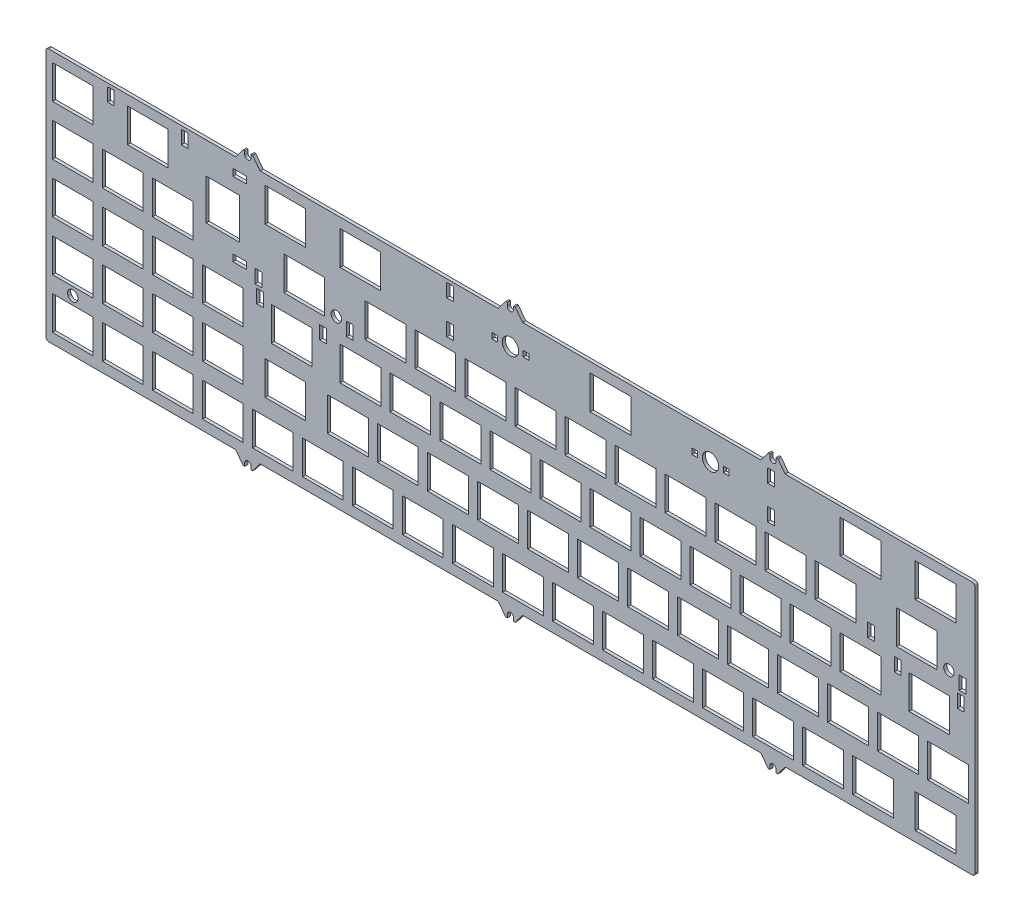
from build123d import *

# Parameters (mm, degrees)
SKETCH2_R           = 3.125
SKETCH2_R_2         = 2
SKETCH2_W           = 15.6
SKETCH2_H           = 12.8
SKETCH2_W_2         = 2.6
SKETCH2_H_2         = 5.1
SKETCH2_W_3         = 2.2
SKETCH2_H_3         = 2.2
SKETCH2_W_4         = 5.1
SKETCH2_H_4         = 2.6
SKETCH2_W_5         = 15.5
SKETCH2_W_6         = 12.8
SKETCH2_H_5         = 15.5
BOSS_EXTRUDE1_DEPTH = 1.2


with BuildPart() as part:
    # Sketch2 → Boss-Extrude1 (new body)
    with BuildSketch(Plane(origin=(0, 0, 0), x_dir=(1, 0, 0), z_dir=(0, 0, -1))):
        with BuildLine():
            Line((-4.122e-06, 4.749999815), (-4.122e-06, 99.349999815))
            ThreePointArc((-4.122e-06, 99.349999815), (0.292889097, 100.057106597), (0.999995878, 100.349999815))
            Line((0.999995878, 100.349999815), (72.237495878, 100.349999815))
            Line((72.237495878, 100.349999815), (75.087495878, 104.099999815))
            Line((75.087495878, 104.099999815), (75.687495878, 104.099999815))
            Line((75.687495878, 104.099999815), (75.687495878, 103.599999815))
            Line((75.687495878, 103.599999815), (75.687495878, 102.849999815))
            ThreePointArc((75.687495878, 102.849999815), (76.887495878, 101.649999815), (78.087495878, 102.849999815))
            Line((78.087495878, 102.849999815), (78.087495878, 103.599999815))
            Line((78.087495878, 103.599999815), (78.087495878, 104.099999815))
            Line((78.087495878, 104.099999815), (78.687495879, 104.099999815))
            Line((78.687495879, 104.099999815), (81.537495879, 100.349999815))
            Line((81.537495879, 100.349999815), (172.237495878, 100.349999815))
            Line((172.237495878, 100.349999815), (175.087495878, 104.099999815))
            Line((175.087495878, 104.099999815), (175.687495878, 104.099999815))
            Line((175.687495878, 104.099999815), (175.687495878, 102.849999815))
            ThreePointArc((175.687495878, 102.849999815), (176.887495878, 101.649999815), (178.087495878, 102.849999815))
            Line((178.087495878, 102.849999815), (178.087495878, 104.099999815))
            Line((178.087495878, 104.099999815), (178.687495878, 104.099999815))
            Line((178.687495878, 104.099999815), (181.537495878, 100.349999815))
            Line((181.537495878, 100.349999815), (272.237495878, 100.349999815))
            Line((272.237495878, 100.349999815), (275.087495878, 104.099999815))
            Line((275.087495878, 104.099999815), (275.687495878, 104.099999815))
            Line((275.687495878, 104.099999815), (275.687495878, 102.849999815))
            ThreePointArc((275.687495878, 102.849999815), (276.887495878, 101.649999815), (278.087495878, 102.849999815))
            Line((278.087495878, 102.849999815), (278.087495878, 104.099999815))
            Line((278.087495878, 104.099999815), (278.687495878, 104.099999815))
            Line((278.687495878, 104.099999815), (281.537495878, 100.349999815))
            Line((281.537495878, 100.349999815), (352.774995878, 100.349999815))
            ThreePointArc((352.774995878, 100.349999815), (353.48210266, 100.057106597), (353.774995878, 99.349999815))
            Line((353.774995878, 99.349999815), (353.774995878, 4.749999815))
            ThreePointArc((353.774995878, 4.749999815), (353.48210266, 4.042893034), (352.774995878, 3.749999815))
            Line((352.774995878, 3.749999815), (281.537495878, 3.749999815))
            Line((281.537495878, 3.749999815), (278.687495878, -1.85e-07))
            Line((278.687495878, -1.85e-07), (278.087495878, -1.85e-07))
            Line((278.087495878, -1.85e-07), (278.087495878, 1.249999815))
            ThreePointArc((278.087495878, 1.249999815), (276.887495878, 2.449999815), (275.687495878, 1.249999815))
            Line((275.687495878, 1.249999815), (275.687495878, -1.85e-07))
            Line((275.687495878, -1.85e-07), (275.087495878, -1.85e-07))
            Line((275.087495878, -1.85e-07), (272.237495878, 3.749999815))
            Line((272.237495878, 3.749999815), (181.537495878, 3.749999815))
            Line((181.537495878, 3.749999815), (178.687495878, -1.85e-07))
            Line((178.687495878, -1.85e-07), (178.087495878, -1.85e-07))
            Line((178.087495878, -1.85e-07), (178.087495878, 1.249999815))
            ThreePointArc((178.087495878, 1.249999815), (176.887495878, 2.449999815), (175.687495878, 1.249999815))
            Line((175.687495878, 1.249999815), (175.687495878, -1.85e-07))
            Line((175.687495878, -1.85e-07), (175.087495878, -1.85e-07))
            Line((175.087495878, -1.85e-07), (172.237495878, 3.749999815))
            Line((172.237495878, 3.749999815), (81.537495879, 3.749999815))
            Line((81.537495879, 3.749999815), (78.687495879, -1.85e-07))
            Line((78.687495879, -1.85e-07), (78.087495878, -1.85e-07))
            Line((78.087495878, -1.85e-07), (78.087495878, 0.499999815))
            Line((78.087495878, 0.499999815), (78.087495878, 1.249999815))
            ThreePointArc((78.087495878, 1.249999815), (76.887495878, 2.449999815), (75.687495878, 1.249999815))
            Line((75.687495878, 1.249999815), (75.687495878, 0.499999815))
            Line((75.687495878, 0.499999815), (75.687495878, -1.85e-07))
            Line((75.687495878, -1.85e-07), (75.087495878, -1.85e-07))
            Line((75.087495878, -1.85e-07), (72.237495878, 3.749999815))
            Line((72.237495878, 3.749999815), (0.999995878, 3.749999815))
            ThreePointArc((0.999995878, 3.749999815), (0.292889097, 4.042893034), (-4.122e-06, 4.749999815))
        make_face()
        with Locations((176.887495878, 13.949999815)):
            Circle(SKETCH2_R, mode=Mode.SUBTRACT)
        with Locations((253.087495878, 13.949999815)):
            Circle(SKETCH2_R, mode=Mode.SUBTRACT)
        with Locations((343.918745878, 37.249999815)):
            Circle(SKETCH2_R_2, mode=Mode.SUBTRACT)
        with Locations((110.556245878, 37.249999815)):
            Circle(SKETCH2_R_2, mode=Mode.SUBTRACT)
        with Locations((10.199995878, 80.624999815)):
            Circle(SKETCH2_R_2, mode=Mode.SUBTRACT)
        with Locations((129.262495878, 32.999999815)):
            Rectangle(SKETCH2_W, SKETCH2_H, mode=Mode.SUBTRACT)
        with Locations((119.737495878, 52.049999815)):
            Rectangle(SKETCH2_W, SKETCH2_H, mode=Mode.SUBTRACT)
        with Locations((114.974995878, 71.099999815)):
            Rectangle(SKETCH2_W, SKETCH2_H, mode=Mode.SUBTRACT)
        with Locations((324.431248691, 45.649999553)):
            Rectangle(SKETCH2_W_2, SKETCH2_H_2, mode=Mode.SUBTRACT)
        with Locations((348.431245878, 45.649999815)):
            Rectangle(SKETCH2_W_2, SKETCH2_H_2, mode=Mode.SUBTRACT)
        with Locations((105.543745878, 45.649999815)):
            Rectangle(SKETCH2_W_2, SKETCH2_H_2, mode=Mode.SUBTRACT)
        with Locations((314.268745878, 39.399999815)):
            Rectangle(SKETCH2_W_2, SKETCH2_H_2, mode=Mode.SUBTRACT)
        with Locations((349.068745878, 39.399999815)):
            Rectangle(SKETCH2_W_2, SKETCH2_H_2, mode=Mode.SUBTRACT)
        with Locations((115.706245878, 39.399999815)):
            Rectangle(SKETCH2_W_2, SKETCH2_H_2, mode=Mode.SUBTRACT)
        with Locations((153.887495878, 7.549999815)):
            Rectangle(SKETCH2_W_2, SKETCH2_H_2, mode=Mode.SUBTRACT)
        with Locations((182.862495878, 13.949999815)):
            Rectangle(SKETCH2_W_3, SKETCH2_H_3, mode=Mode.SUBTRACT)
        with Locations((170.912495878, 13.949999815)):
            Rectangle(SKETCH2_W_3, SKETCH2_H_3, mode=Mode.SUBTRACT)
        with Locations((247.112495878, 13.949999815)):
            Rectangle(SKETCH2_W_3, SKETCH2_H_3, mode=Mode.SUBTRACT)
        with Locations((259.062495878, 13.949999815)):
            Rectangle(SKETCH2_W_3, SKETCH2_H_3, mode=Mode.SUBTRACT)
        with Locations((81.543748691, 45.649999553)):
            Rectangle(SKETCH2_W_2, SKETCH2_H_2, mode=Mode.SUBTRACT)
        with Locations((80.906245878, 39.399999815)):
            Rectangle(SKETCH2_W_2, SKETCH2_H_2, mode=Mode.SUBTRACT)
        with Locations((24.674995878, 7.549999815)):
            Rectangle(SKETCH2_W_2, SKETCH2_H_2, mode=Mode.SUBTRACT)
        with Locations((52.874995878, 7.549999815)):
            Rectangle(SKETCH2_W_2, SKETCH2_H_2, mode=Mode.SUBTRACT)
        with Locations((73.749995878, 9.374999815)):
            Rectangle(SKETCH2_W_4, SKETCH2_H_4, mode=Mode.SUBTRACT)
        with Locations((73.749995878, 37.574999815)):
            Rectangle(SKETCH2_W_4, SKETCH2_H_4, mode=Mode.SUBTRACT)
        with Locations((153.887495878, 20.349999815)):
            Rectangle(SKETCH2_W_2, SKETCH2_H_2, mode=Mode.SUBTRACT)
        with Locations((276.087495878, 20.349999815)):
            Rectangle(SKETCH2_W_2, SKETCH2_H_2, mode=Mode.SUBTRACT)
        with Locations((276.087495878, 7.549999815)):
            Rectangle(SKETCH2_W_2, SKETCH2_H_2, mode=Mode.SUBTRACT)
        with Locations((338.812495878, 90.149999815)):
            Rectangle(SKETCH2_W_5, SKETCH2_H, mode=Mode.SUBTRACT)
        with Locations((314.999995878, 90.149999815)):
            Rectangle(SKETCH2_W_5, SKETCH2_H, mode=Mode.SUBTRACT)
        with Locations((295.949995878, 90.149999815)):
            Rectangle(SKETCH2_W_5, SKETCH2_H, mode=Mode.SUBTRACT)
        with Locations((276.899995878, 90.149999815)):
            Rectangle(SKETCH2_W_5, SKETCH2_H, mode=Mode.SUBTRACT)
        with Locations((257.849995878, 90.149999815)):
            Rectangle(SKETCH2_W_5, SKETCH2_H, mode=Mode.SUBTRACT)
        with Locations((238.799995878, 90.149999815)):
            Rectangle(SKETCH2_W_5, SKETCH2_H, mode=Mode.SUBTRACT)
        with Locations((219.749995878, 90.149999815)):
            Rectangle(SKETCH2_W_5, SKETCH2_H, mode=Mode.SUBTRACT)
        with Locations((200.699995878, 90.149999815)):
            Rectangle(SKETCH2_W_5, SKETCH2_H, mode=Mode.SUBTRACT)
        with Locations((181.649995878, 90.149999815)):
            Rectangle(SKETCH2_W_5, SKETCH2_H, mode=Mode.SUBTRACT)
        with Locations((162.599995878, 90.149999815)):
            Rectangle(SKETCH2_W_5, SKETCH2_H, mode=Mode.SUBTRACT)
        with Locations((143.549995878, 90.149999815)):
            Rectangle(SKETCH2_W_5, SKETCH2_H, mode=Mode.SUBTRACT)
        with Locations((124.499995878, 90.149999815)):
            Rectangle(SKETCH2_W_5, SKETCH2_H, mode=Mode.SUBTRACT)
        with Locations((105.449995878, 90.149999815)):
            Rectangle(SKETCH2_W_5, SKETCH2_H, mode=Mode.SUBTRACT)
        with Locations((86.399995878, 90.149999815)):
            Rectangle(SKETCH2_W_5, SKETCH2_H, mode=Mode.SUBTRACT)
        with Locations((67.349995878, 71.099999815)):
            Rectangle(SKETCH2_W_5, SKETCH2_H, mode=Mode.SUBTRACT)
        with Locations((67.349995878, 90.149999815)):
            Rectangle(SKETCH2_W_5, SKETCH2_H, mode=Mode.SUBTRACT)
        with Locations((48.299995878, 71.099999815)):
            Rectangle(SKETCH2_W_5, SKETCH2_H, mode=Mode.SUBTRACT)
        with Locations((48.299995878, 90.149999815)):
            Rectangle(SKETCH2_W_5, SKETCH2_H, mode=Mode.SUBTRACT)
        with Locations((29.249995878, 71.099999815)):
            Rectangle(SKETCH2_W_5, SKETCH2_H, mode=Mode.SUBTRACT)
        with Locations((29.249995878, 90.149999815)):
            Rectangle(SKETCH2_W_5, SKETCH2_H, mode=Mode.SUBTRACT)
        with Locations((10.199995878, 71.099999815)):
            Rectangle(SKETCH2_W_5, SKETCH2_H, mode=Mode.SUBTRACT)
        with Locations((10.199995878, 90.149999815)):
            Rectangle(SKETCH2_W_5, SKETCH2_H, mode=Mode.SUBTRACT)
        with Locations((67.299995878, 52.049999815)):
            Rectangle(SKETCH2_W_5, SKETCH2_H, mode=Mode.SUBTRACT)
        with Locations((48.249995878, 52.049999815)):
            Rectangle(SKETCH2_W_5, SKETCH2_H, mode=Mode.SUBTRACT)
        with Locations((29.199995878, 52.049999815)):
            Rectangle(SKETCH2_W_5, SKETCH2_H, mode=Mode.SUBTRACT)
        with Locations((10.149995878, 52.049999815)):
            Rectangle(SKETCH2_W_5, SKETCH2_H, mode=Mode.SUBTRACT)
        with Locations((48.249995878, 32.999999815)):
            Rectangle(SKETCH2_W_5, SKETCH2_H, mode=Mode.SUBTRACT)
        with Locations((29.199995878, 32.999999815)):
            Rectangle(SKETCH2_W_5, SKETCH2_H, mode=Mode.SUBTRACT)
        with Locations((10.149995878, 32.999999815)):
            Rectangle(SKETCH2_W_5, SKETCH2_H, mode=Mode.SUBTRACT)
        with Locations((10.199995878, 13.949999815)):
            Rectangle(SKETCH2_W_5, SKETCH2_H, mode=Mode.SUBTRACT)
        with Locations((38.774995878, 13.949999815)):
            Rectangle(SKETCH2_W_5, SKETCH2_H, mode=Mode.SUBTRACT)
        with Locations((91.162495878, 13.949999815)):
            Rectangle(SKETCH2_W_5, SKETCH2_H, mode=Mode.SUBTRACT)
        with Locations((119.737495878, 13.949999815)):
            Rectangle(SKETCH2_W_5, SKETCH2_H, mode=Mode.SUBTRACT)
        with Locations((98.306245878, 32.999999815)):
            Rectangle(SKETCH2_W_5, SKETCH2_H, mode=Mode.SUBTRACT)
        with Locations((93.543745878, 52.049999815)):
            Rectangle(SKETCH2_W_5, SKETCH2_H, mode=Mode.SUBTRACT)
        with Locations((91.162495878, 71.099999815)):
            Rectangle(SKETCH2_W_5, SKETCH2_H, mode=Mode.SUBTRACT)
        with Locations((336.431245878, 52.049999815)):
            Rectangle(SKETCH2_W_5, SKETCH2_H, mode=Mode.SUBTRACT)
        with Locations((214.987495878, 13.949999815)):
            Rectangle(SKETCH2_W_5, SKETCH2_H, mode=Mode.SUBTRACT)
        with Locations((310.237495879, 13.949999815)):
            Rectangle(SKETCH2_W_5, SKETCH2_H, mode=Mode.SUBTRACT)
        with Locations((331.668745878, 32.999999815)):
            Rectangle(SKETCH2_W_5, SKETCH2_H, mode=Mode.SUBTRACT)
        with Locations((338.812495879, 13.949999815)):
            Rectangle(SKETCH2_W_5, SKETCH2_H, mode=Mode.SUBTRACT)
        with Locations((67.349995878, 23.474999815)):
            Rectangle(SKETCH2_W_6, SKETCH2_H_5, mode=Mode.SUBTRACT)
        with Locations((286.424995878, 71.099999815)):
            Rectangle(SKETCH2_W_5, SKETCH2_H, mode=Mode.SUBTRACT)
        with Locations((267.374995878, 71.099999815)):
            Rectangle(SKETCH2_W_5, SKETCH2_H, mode=Mode.SUBTRACT)
        with Locations((248.324995878, 71.099999815)):
            Rectangle(SKETCH2_W_5, SKETCH2_H, mode=Mode.SUBTRACT)
        with Locations((229.274995878, 71.099999815)):
            Rectangle(SKETCH2_W_5, SKETCH2_H, mode=Mode.SUBTRACT)
        with Locations((210.224995878, 71.099999815)):
            Rectangle(SKETCH2_W_5, SKETCH2_H, mode=Mode.SUBTRACT)
        with Locations((191.174995878, 71.099999815)):
            Rectangle(SKETCH2_W_5, SKETCH2_H, mode=Mode.SUBTRACT)
        with Locations((172.124995878, 71.099999815)):
            Rectangle(SKETCH2_W_5, SKETCH2_H, mode=Mode.SUBTRACT)
        with Locations((153.074995878, 71.099999815)):
            Rectangle(SKETCH2_W_5, SKETCH2_H, mode=Mode.SUBTRACT)
        with Locations((134.024995878, 71.099999815)):
            Rectangle(SKETCH2_W_5, SKETCH2_H, mode=Mode.SUBTRACT)
        with Locations((291.187495878, 52.049999815)):
            Rectangle(SKETCH2_W_5, SKETCH2_H, mode=Mode.SUBTRACT)
        with Locations((272.137495878, 52.049999815)):
            Rectangle(SKETCH2_W_5, SKETCH2_H, mode=Mode.SUBTRACT)
        with Locations((253.087495878, 52.049999815)):
            Rectangle(SKETCH2_W_5, SKETCH2_H, mode=Mode.SUBTRACT)
        with Locations((234.037495878, 52.049999815)):
            Rectangle(SKETCH2_W_5, SKETCH2_H, mode=Mode.SUBTRACT)
        with Locations((214.987495878, 52.049999815)):
            Rectangle(SKETCH2_W_5, SKETCH2_H, mode=Mode.SUBTRACT)
        with Locations((195.937495878, 52.049999815)):
            Rectangle(SKETCH2_W_5, SKETCH2_H, mode=Mode.SUBTRACT)
        with Locations((176.887495878, 52.049999815)):
            Rectangle(SKETCH2_W_5, SKETCH2_H, mode=Mode.SUBTRACT)
        with Locations((157.837495878, 52.049999815)):
            Rectangle(SKETCH2_W_5, SKETCH2_H, mode=Mode.SUBTRACT)
        with Locations((138.787495878, 52.049999815)):
            Rectangle(SKETCH2_W_5, SKETCH2_H, mode=Mode.SUBTRACT)
        with Locations((300.712495878, 32.999999815)):
            Rectangle(SKETCH2_W_5, SKETCH2_H, mode=Mode.SUBTRACT)
        with Locations((281.662495878, 32.999999815)):
            Rectangle(SKETCH2_W_5, SKETCH2_H, mode=Mode.SUBTRACT)
        with Locations((262.612495878, 32.999999815)):
            Rectangle(SKETCH2_W_5, SKETCH2_H, mode=Mode.SUBTRACT)
        with Locations((243.562495878, 32.999999815)):
            Rectangle(SKETCH2_W_5, SKETCH2_H, mode=Mode.SUBTRACT)
        with Locations((224.512495878, 32.999999815)):
            Rectangle(SKETCH2_W_5, SKETCH2_H, mode=Mode.SUBTRACT)
        with Locations((205.462495878, 32.999999815)):
            Rectangle(SKETCH2_W_5, SKETCH2_H, mode=Mode.SUBTRACT)
        with Locations((186.412495878, 32.999999815)):
            Rectangle(SKETCH2_W_5, SKETCH2_H, mode=Mode.SUBTRACT)
        with Locations((167.362495878, 32.999999815)):
            Rectangle(SKETCH2_W_5, SKETCH2_H, mode=Mode.SUBTRACT)
        with Locations((148.312495878, 32.999999815)):
            Rectangle(SKETCH2_W_5, SKETCH2_H, mode=Mode.SUBTRACT)
        with Locations((343.574995878, 71.099999815)):
            Rectangle(SKETCH2_W_5, SKETCH2_H, mode=Mode.SUBTRACT)
        with Locations((324.524995878, 71.099999815)):
            Rectangle(SKETCH2_W_5, SKETCH2_H, mode=Mode.SUBTRACT)
        with Locations((305.474995878, 71.099999815)):
            Rectangle(SKETCH2_W_5, SKETCH2_H, mode=Mode.SUBTRACT)
        with Locations((310.237495878, 52.049999815)):
            Rectangle(SKETCH2_W_5, SKETCH2_H, mode=Mode.SUBTRACT)
    extrude(amount=-BOSS_EXTRUDE1_DEPTH)


solid = part.part
